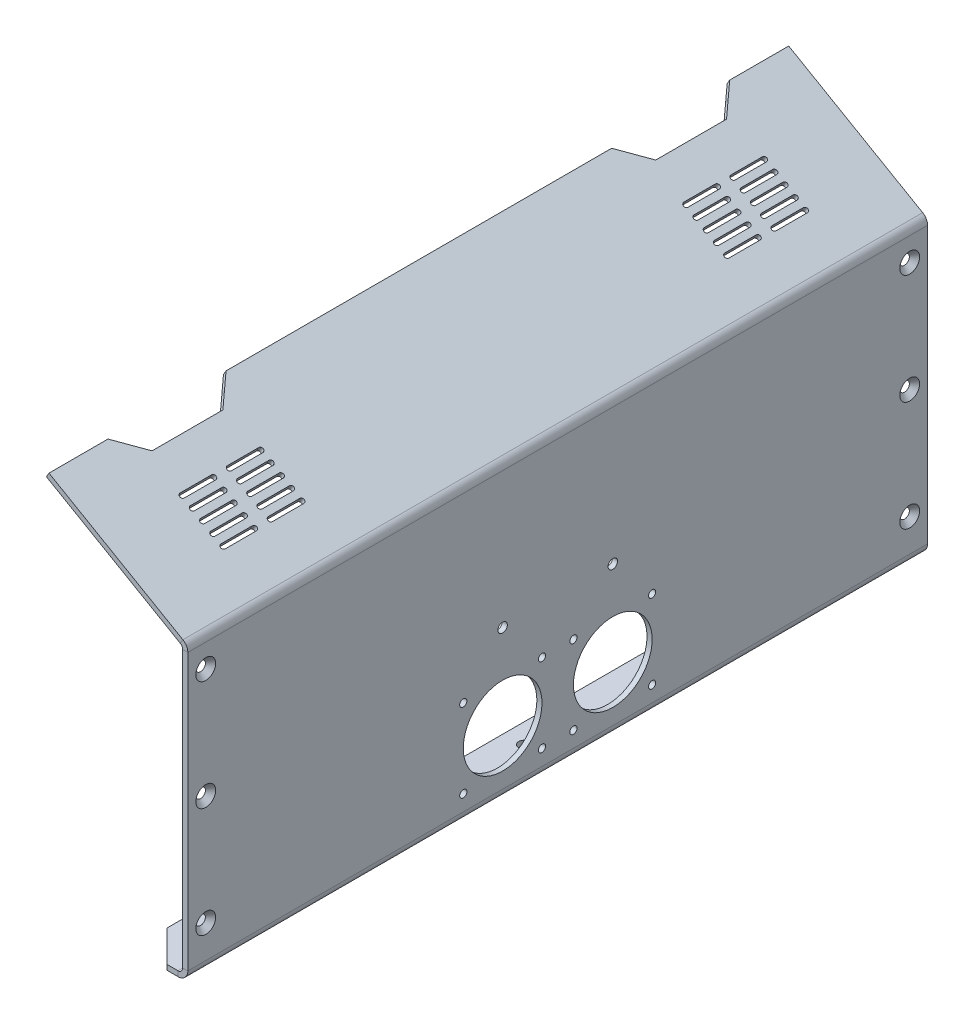
from build123d import *

# Parameters (mm, degrees)
BASE_FLANGE1_DEPTH = 235
SKETCH6_R          = 3.5
CUT_EXTRUDE1_DEPTH = 10
CHAMFER1_SIZE      = 20
SKETCH8_R          = 3
CUT_EXTRUDE3_DEPTH = 3.26
SKETCH11_R         = 2.286
SKETCH11_R_2       = 25
CUT_EXTRUDE5_DEPTH = 3.26
SKETCH14_R         = 3
CUT_EXTRUDE7_DEPTH = 10
CUT_EXTRUDE8_DEPTH = 10
SKETCH16_W         = 15
SKETCH16_H         = 60
CUT_EXTRUDE9_DEPTH = 10
CHAMFER2_SIZE      = 7.5
CHAMFER3_SIZE      = 3.3


# Sheet-metal steps are written as plain solids
# Some blends are built 0.0001 mm under size
with BuildPart() as part:
    # Sketch1 → Base-Flange1 (new, symmetric)
    with BuildSketch(Plane.XY):
        with BuildLine():
            Line((-30, 0), (-3, 0))
            ThreePointArc((-3, 0), (-0.878679656, 0.878679656), (0, 3))
            Line((0, 3), (0, 178.267949192))
            ThreePointArc((0, 178.267949192), (-0.401923789, 179.767949192), (-1.5, 180.866025404))
            Line((-1.5, 180.866025404), (-86.602540378, 230))
            Line((-86.602540378, 230), (-84.972540378, 232.823242816))
            Line((-84.972540378, 232.823242816), (0.13, 183.68926822))
            ThreePointArc((0.13, 183.68926822), (2.421319028, 181.397949192), (3.26, 178.267949192))
            Line((3.26, 178.267949192), (3.26, 3))
            ThreePointArc((3.26, 3), (1.42648845, -1.42648845), (-3, -3.26))
            Line((-3, -3.26), (-30, -3.26))
            Line((-30, -3.26), (-30, 0))
        make_face()
    extrude(amount=BASE_FLANGE1_DEPTH, both=True)

    # Sketch6 → Cut-Extrude1 (cut)
    with BuildSketch(Plane(origin=(0, 0, 0), x_dir=(1, 0, 0), z_dir=(0, 1, 0))):
        with Locations(Location((-17.387, -0.59516, 0), (0, 0, 270))):
            Circle(SKETCH6_R)
        with Locations(Location((-17.387, -200.59516, 0), (0, 0, 270))):
            Circle(SKETCH6_R)
        with Locations(Location((-17.387, -100.59516, 0), (0, 0, 270))):
            Circle(SKETCH6_R)
        with Locations(Location((-17.387, 199.40484, 0), (0, 0, 270))):
            Circle(SKETCH6_R)
        with Locations(Location((-17.387, 99.40484, 0), (0, 0, 270))):
            Circle(SKETCH6_R)
    extrude(amount=-CUT_EXTRUDE1_DEPTH, mode=Mode.SUBTRACT)

    # Chamfer1
    chamfer1_edges = [part.edges().sort_by_distance(p)[0] for p in [
        (-30, -1.63, -235),
        (-30, -1.63, 235),
    ]]
    chamfer(chamfer1_edges, length=CHAMFER1_SIZE)

    # Sketch8 → Cut-Extrude3 (cut)
    with BuildSketch(Plane(origin=(3.26, 0, 0), x_dir=(0, 0, -1), z_dir=(1, 0, 0))):
        with Locations((-223.61916, 163.426)):
            Circle(SKETCH8_R)
        with Locations((-223.61916, 93.576)):
            Circle(SKETCH8_R)
        with Locations((-223.61916, 23.726)):
            Circle(SKETCH8_R)
        with Locations(Location((223.61916, 23.726, 0), (0, 0, 180))):
            Circle(SKETCH8_R)
        with Locations(Location((223.61916, 93.576, 0), (0, 0, 180))):
            Circle(SKETCH8_R)
        with Locations(Location((223.61916, 163.426, 0), (0, 0, 180))):
            Circle(SKETCH8_R)
    extrude(amount=-CUT_EXTRUDE3_DEPTH, mode=Mode.SUBTRACT)

    # Sketch11 → Cut-Extrude5 (cut)
    with BuildSketch(Plane(origin=(3.26, 0, 0), x_dir=(0, 0, -1), z_dir=(1, 0, 0))):
        with Locations(Location((-60, 63, 0), (0, 0, 90))):
            Circle(SKETCH11_R)
        with Locations(Location((-10, 63, 0), (0, 0, 90))):
            Circle(SKETCH11_R)
        with Locations(Location((-10, 13, 0), (0, 0, 90))):
            Circle(SKETCH11_R)
        with Locations(Location((-60, 13, 0), (0, 0, 90))):
            Circle(SKETCH11_R)
        with Locations(Location((-35, 38, 0), (0, 0, 90))):
            Circle(SKETCH11_R_2)
        with Locations(Location((35, 38, 0), (0, 0, 180))):
            Circle(SKETCH11_R_2)
        with Locations(Location((60, 13, 0), (0, 0, 180))):
            Circle(SKETCH11_R)
        with Locations(Location((10, 13, 0), (0, 0, 180))):
            Circle(SKETCH11_R)
        with Locations(Location((10, 63, 0), (0, 0, 180))):
            Circle(SKETCH11_R)
        with Locations(Location((60, 63, 0), (0, 0, 180))):
            Circle(SKETCH11_R)
    extrude(amount=-CUT_EXTRUDE5_DEPTH, mode=Mode.SUBTRACT)

    # Sketch14 → Cut-Extrude7 (cut)
    with BuildSketch(Plane.ZY):
        with Locations((35, 91.949)):
            Circle(SKETCH14_R)
        with Locations((-35, 91.949)):
            Circle(SKETCH14_R)
    extrude(amount=-CUT_EXTRUDE7_DEPTH, mode=Mode.SUBTRACT)

    # Sketch15 → Cut-Extrude8 (cut)
    with BuildSketch(Plane(origin=(79.572286341, 137.823242816, 0), x_dir=(0.8660254037844399, -0.4999999999999977, 0), z_dir=(0.4999999999999977, 0.8660254037844399, 0))):
        with BuildLine():
            Line((-148.5, -165), (-148.5, -185))
            ThreePointArc((-148.5, -185), (-150, -186.5), (-151.5, -185))
            Line((-151.5, -185), (-151.5, -165))
            ThreePointArc((-151.5, -165), (-150, -163.5), (-148.5, -165))
        make_face()
        with BuildLine():
            Line((-141, -165), (-141, -185))
            ThreePointArc((-141, -185), (-142.5, -186.5), (-144, -185))
            Line((-144, -185), (-144, -165))
            ThreePointArc((-144, -165), (-142.5, -163.5), (-141, -165))
        make_face()
        with BuildLine():
            Line((-133.5, -165), (-133.5, -185))
            ThreePointArc((-133.5, -185), (-135, -186.5), (-136.5, -185))
            Line((-136.5, -185), (-136.5, -165))
            ThreePointArc((-136.5, -165), (-135, -163.5), (-133.5, -165))
        make_face()
        with BuildLine():
            Line((-126, -165), (-126, -185))
            ThreePointArc((-126, -185), (-127.5, -186.5), (-129, -185))
            Line((-129, -185), (-129, -165))
            ThreePointArc((-129, -165), (-127.5, -163.5), (-126, -165))
        make_face()
        with BuildLine():
            Line((-118.5, -165), (-118.5, -185))
            ThreePointArc((-118.5, -185), (-120, -186.5), (-121.5, -185))
            Line((-121.5, -185), (-121.5, -165))
            ThreePointArc((-121.5, -165), (-120, -163.5), (-118.5, -165))
        make_face()
        with BuildLine():
            Line((-141, -135), (-141, -155))
            ThreePointArc((-141, -155), (-142.5, -156.5), (-144, -155))
            Line((-144, -155), (-144, -135))
            ThreePointArc((-144, -135), (-142.5, -133.5), (-141, -135))
        make_face()
        with BuildLine():
            Line((-133.5, -135), (-133.5, -155))
            ThreePointArc((-133.5, -155), (-135, -156.5), (-136.5, -155))
            Line((-136.5, -155), (-136.5, -135))
            ThreePointArc((-136.5, -135), (-135, -133.5), (-133.5, -135))
        make_face()
        with BuildLine():
            Line((-126, -135), (-126, -155))
            ThreePointArc((-126, -155), (-127.5, -156.5), (-129, -155))
            Line((-129, -155), (-129, -135))
            ThreePointArc((-129, -135), (-127.5, -133.5), (-126, -135))
        make_face()
        with BuildLine():
            Line((-118.5, -135), (-118.5, -155))
            ThreePointArc((-118.5, -155), (-120, -156.5), (-121.5, -155))
            Line((-121.5, -155), (-121.5, -135))
            ThreePointArc((-121.5, -135), (-120, -133.5), (-118.5, -135))
        make_face()
        with BuildLine():
            Line((-148.5, -135), (-148.5, -155))
            ThreePointArc((-148.5, -155), (-150, -156.5), (-151.5, -155))
            Line((-151.5, -155), (-151.5, -135))
            ThreePointArc((-151.5, -135), (-150, -133.5), (-148.5, -135))
        make_face()
        with BuildLine():
            Line((-148.5, 165), (-148.5, 185))
            ThreePointArc((-148.5, 185), (-150, 186.5), (-151.5, 185))
            Line((-151.5, 185), (-151.5, 165))
            ThreePointArc((-151.5, 165), (-150, 163.5), (-148.5, 165))
        make_face()
        with BuildLine():
            Line((-141, 165), (-141, 185))
            ThreePointArc((-141, 185), (-142.5, 186.5), (-144, 185))
            Line((-144, 185), (-144, 165))
            ThreePointArc((-144, 165), (-142.5, 163.5), (-141, 165))
        make_face()
        with BuildLine():
            Line((-133.5, 165), (-133.5, 185))
            ThreePointArc((-133.5, 185), (-135, 186.5), (-136.5, 185))
            Line((-136.5, 185), (-136.5, 165))
            ThreePointArc((-136.5, 165), (-135, 163.5), (-133.5, 165))
        make_face()
        with BuildLine():
            Line((-126, 165), (-126, 185))
            ThreePointArc((-126, 185), (-127.5, 186.5), (-129, 185))
            Line((-129, 185), (-129, 165))
            ThreePointArc((-129, 165), (-127.5, 163.5), (-126, 165))
        make_face()
        with BuildLine():
            Line((-118.5, 165), (-118.5, 185))
            ThreePointArc((-118.5, 185), (-120, 186.5), (-121.5, 185))
            Line((-121.5, 185), (-121.5, 165))
            ThreePointArc((-121.5, 165), (-120, 163.5), (-118.5, 165))
        make_face()
        with BuildLine():
            Line((-141, 135), (-141, 155))
            ThreePointArc((-141, 155), (-142.5, 156.5), (-144, 155))
            Line((-144, 155), (-144, 135))
            ThreePointArc((-144, 135), (-142.5, 133.5), (-141, 135))
        make_face()
        with BuildLine():
            Line((-133.5, 135), (-133.5, 155))
            ThreePointArc((-133.5, 155), (-135, 156.5), (-136.5, 155))
            Line((-136.5, 155), (-136.5, 135))
            ThreePointArc((-136.5, 135), (-135, 133.5), (-133.5, 135))
        make_face()
        with BuildLine():
            Line((-126, 135), (-126, 155))
            ThreePointArc((-126, 155), (-127.5, 156.5), (-129, 155))
            Line((-129, 155), (-129, 135))
            ThreePointArc((-129, 135), (-127.5, 133.5), (-126, 135))
        make_face()
        with BuildLine():
            Line((-118.5, 135), (-118.5, 155))
            ThreePointArc((-118.5, 155), (-120, 156.5), (-121.5, 155))
            Line((-121.5, 155), (-121.5, 135))
            ThreePointArc((-121.5, 135), (-120, 133.5), (-118.5, 135))
        make_face()
        with BuildLine():
            Line((-148.5, 135), (-148.5, 155))
            ThreePointArc((-148.5, 155), (-150, 156.5), (-151.5, 155))
            Line((-151.5, 155), (-151.5, 135))
            ThreePointArc((-151.5, 135), (-150, 133.5), (-148.5, 135))
        make_face()
    extrude(amount=-CUT_EXTRUDE8_DEPTH, mode=Mode.SUBTRACT)

    # Sketch16 → Cut-Extrude9 (cut)
    with BuildSketch(Plane(origin=(79.572286341, 137.823242816, 0), x_dir=(0.8660254037844399, -0.4999999999999977, 0), z_dir=(0.4999999999999977, 0.8660254037844399, 0))):
        with Locations((-182.5, -160)):
            Rectangle(SKETCH16_W, SKETCH16_H)
        with Locations((-182.5, 160)):
            Rectangle(SKETCH16_W, SKETCH16_H)
    extrude(amount=-CUT_EXTRUDE9_DEPTH, mode=Mode.SUBTRACT)

    # Chamfer2
    chamfer2_edges = [part.edges().sort_by_distance(p)[0] for p in [
        (-72.797159322, 223.911621408, -190),
        (-72.797159322, 223.911621408, -130),
        (-72.797159322, 223.911621408, 130),
        (-72.797159322, 223.911621408, 190),
    ]]
    chamfer(chamfer2_edges, length=CHAMFER2_SIZE)
    chamfer2_2_edges = [part.edges().sort_by_distance(p)[0] for p in [
        (-85.787540378, 231.411621408, -190),
        (-85.787540378, 231.411621408, -130),
        (-85.787540378, 231.411621408, 130),
        (-85.787540378, 231.411621408, 190),
    ]]
    chamfer(chamfer2_2_edges, length=CHAMFER2_SIZE - 0.0001)  # a hair under: the kernel refuses the full size

    # Chamfer3
    # the kernel refuses this chamfer: 3.3 mm, written as the material it takes off along each edge
    with BuildSketch(Plane(origin=(3.26, 163.426, 223.61916), x_dir=(0, 0, -1), z_dir=(0, -1, 0))) as chamfer3_piece_1:
        Polygon((3 + CHAMFER3_SIZE, 0), (3, -CHAMFER3_SIZE), (3, 0), align=None)
    revolve(axis=Axis((3.26, 163.426, 223.61916), (1, 0, 0)), mode=Mode.SUBTRACT)
    with BuildSketch(Plane(origin=(3.26, 163.426, -223.61916), x_dir=(0, 0, 1), z_dir=(0, 1, 0))) as chamfer3_piece_2:
        Polygon((3 + CHAMFER3_SIZE, 0), (3, -CHAMFER3_SIZE), (3, 0), align=None)
    revolve(axis=Axis((3.26, 163.426, -223.61916), (1, 0, 0)), mode=Mode.SUBTRACT)
    with BuildSketch(Plane(origin=(3.26, 93.576, -223.61916), x_dir=(0, 0, 1), z_dir=(0, 1, 0))) as chamfer3_piece_3:
        Polygon((3 + CHAMFER3_SIZE, 0), (3, -CHAMFER3_SIZE), (3, 0), align=None)
    revolve(axis=Axis((3.26, 93.576, -223.61916), (1, 0, 0)), mode=Mode.SUBTRACT)
    with BuildSketch(Plane(origin=(3.26, 23.726, -223.61916), x_dir=(0, 0, 1), z_dir=(0, 1, 0))) as chamfer3_piece_4:
        Polygon((3 + CHAMFER3_SIZE, 0), (3, -CHAMFER3_SIZE), (3, 0), align=None)
    revolve(axis=Axis((3.26, 23.726, -223.61916), (1, 0, 0)), mode=Mode.SUBTRACT)
    with BuildSketch(Plane(origin=(3.26, 23.726, 223.61916), x_dir=(0, 0, -1), z_dir=(0, -1, 0))) as chamfer3_piece_5:
        Polygon((3 + CHAMFER3_SIZE, 0), (3, -CHAMFER3_SIZE), (3, 0), align=None)
    revolve(axis=Axis((3.26, 23.726, 223.61916), (1, 0, 0)), mode=Mode.SUBTRACT)
    with BuildSketch(Plane(origin=(3.26, 93.576, 223.61916), x_dir=(0, 0, -1), z_dir=(0, -1, 0))) as chamfer3_piece_6:
        Polygon((3 + CHAMFER3_SIZE, 0), (3, -CHAMFER3_SIZE), (3, 0), align=None)
    revolve(axis=Axis((3.26, 93.576, 223.61916), (1, 0, 0)), mode=Mode.SUBTRACT)


solid = part.part
